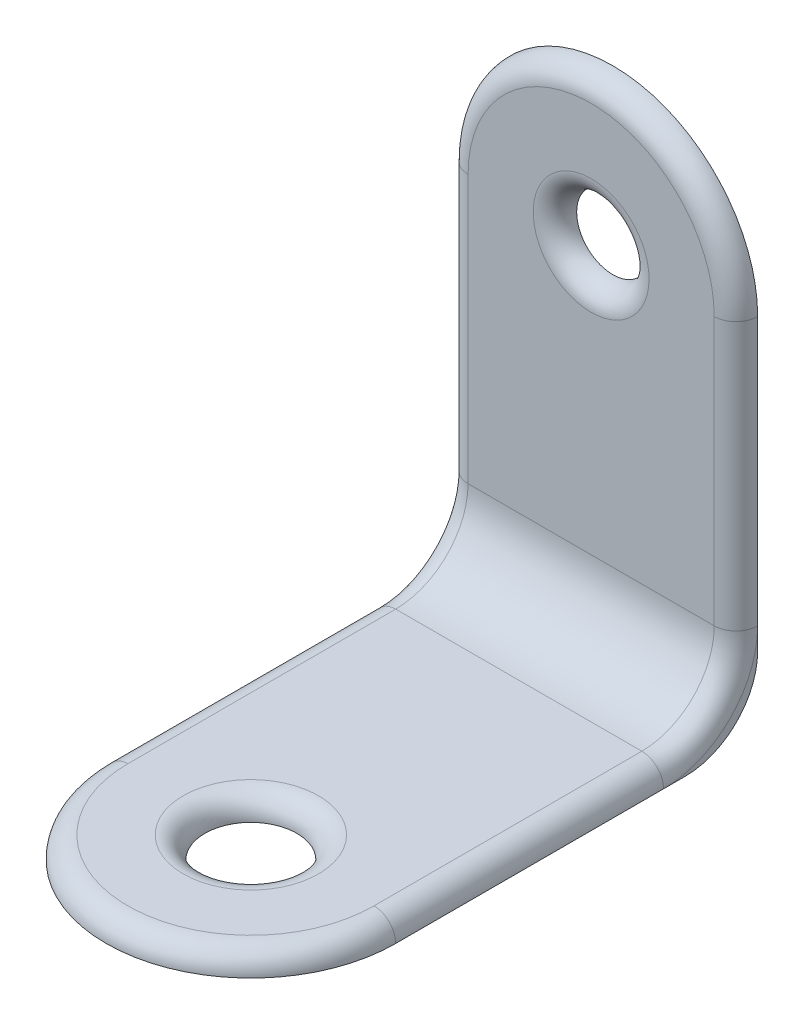
from build123d import *

# Parameters (mm, degrees)
SKETCH1_R           = 20
SKETCH1_R_2         = 6.35
BOSS_EXTRUDE1_DEPTH = 3
SKETCH2_R           = 5
BOSS_EXTRUDE2_DEPTH = 3
FILLET1_R           = 10
FILLET2_R           = 10
FILLET3_R           = 3
FILLET4_R           = 3


with BuildPart() as part:
    # Sketch1 → Boss-Extrude1 (new body)
    # profile 1 of 2: a face of its own
    with BuildSketch(Plane(origin=(0, 0, 0), x_dir=(1, 0, 0), z_dir=(0, 1, 0))):
        with BuildLine():
            Line((-20, 50), (-20, 0))
            ThreePointArc((-20, 0), (0, 20), (20, 0))
            Line((20, 0), (20, 50))
            Line((20, 50), (-20, 50))
        make_face()
    # profile 2 of 2: a face of its own
    with BuildSketch(Plane(origin=(0, 0, 0), x_dir=(1, 0, 0), z_dir=(0, 1, 0))):
        Circle(SKETCH1_R)
        with Locations(Location((0, 0, 0), (0, 0, 270))):
            Circle(SKETCH1_R_2, mode=Mode.SUBTRACT)
    extrude(amount=BOSS_EXTRUDE1_DEPTH)

    # Sketch2 → Boss-Extrude2 (add)
    with BuildSketch(Plane(origin=(0, 0, -50), x_dir=(-1, 0, 0), z_dir=(0, 0, -1))):
        with BuildLine():
            Line((-20, 3), (-20, 50))
            ThreePointArc((-20, 50), (0, 70), (20, 50))
            Line((20, 50), (20, 3))
            Line((20, 3), (20, 0))
            Line((20, 0), (-20, 0))
            Line((-20, 0), (-20, 3))
        make_face()
        with Locations((0, 50)):
            Circle(SKETCH2_R, mode=Mode.SUBTRACT)
    extrude(amount=-BOSS_EXTRUDE2_DEPTH)

    # Fillet1
    fillet1_edges = [part.edges().sort_by_distance(p)[0] for p in [
        (0, 3, -47),
    ]]
    fillet(fillet1_edges, radius=FILLET1_R)

    # Fillet2
    fillet2_edges = [part.edges().sort_by_distance(p)[0] for p in [
        (0, 0, -50),
    ]]
    fillet(fillet2_edges, radius=FILLET2_R)

    # Fillet3
    fillet3_edges = [part.edges().sort_by_distance(p)[0] for p in [
        (20, 5.928932188, -44.071067812),
        (20, 31.5, -47),
        (0, 70, -47),
        (-20, 31.5, -47),
        (-20, 5.928932188, -44.071067812),
        (0, 3, -6.35),
        (0, 3, 20),
        (-20, 3, -18.5),
        (20, 3, -18.5),
    ]]
    fillet(fillet3_edges, radius=FILLET3_R - 0.0001)  # a hair under: the kernel refuses the full size

    # Fillet4
    fillet4_edges = [part.edges().sort_by_distance(p)[0] for p in [
        (5, 50, -47),
    ]]
    fillet(fillet4_edges, radius=FILLET4_R - 0.0001)  # a hair under: the kernel refuses the full size


solid = part.part
